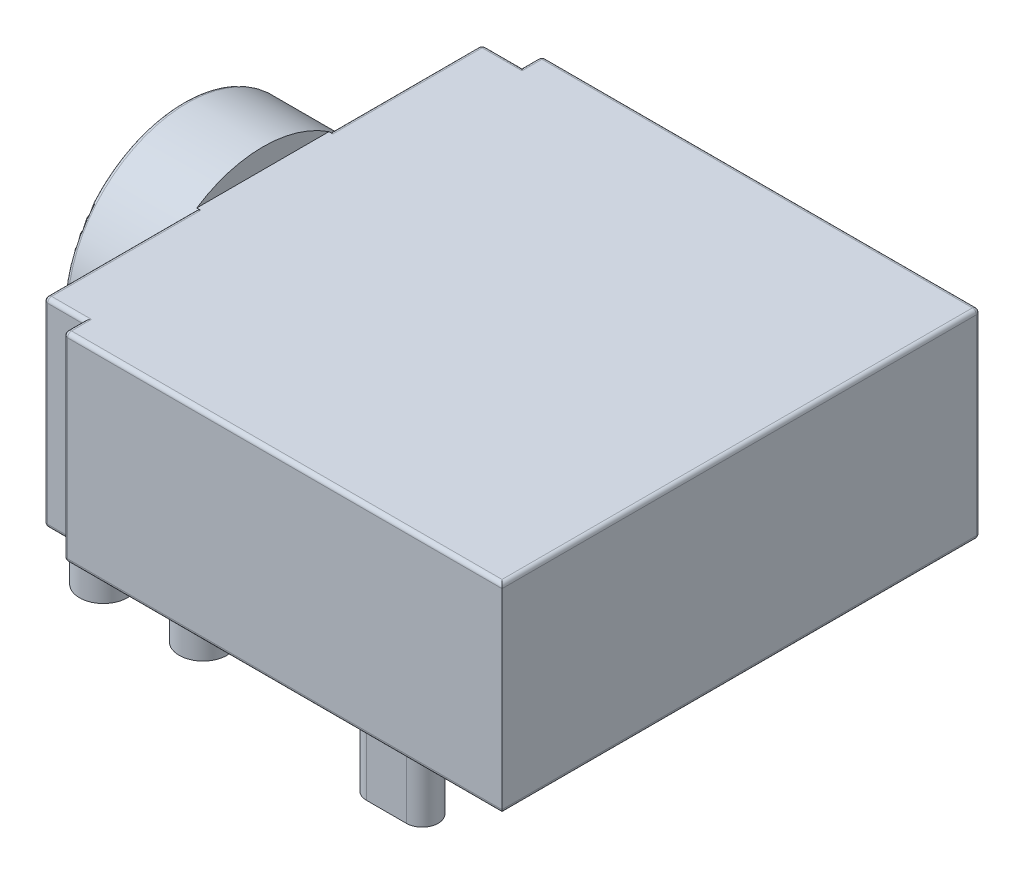
from build123d import *

# Parameters (mm, degrees)
SKETCH_1_W          = 11
SKETCH_1_H          = 12
EXTRUDE_1_DEPTH     = 5
SKETCH_2_W          = 11
SKETCH_2_H          = 5
EXTRUDE_2_DEPTH     = 1
SKETCH_3_R          = 3
EXTRUDE_3_DEPTH     = 2
SKETCH_4_R          = 1.8
CUT_EXTRUDE_1_DEPTH = 2
FILLET_1_R          = 0.1
FILLET_2_R          = 0.1
EXTRUDE_4_DEPTH     = 2
SKETCH_6_R          = 0.6
EXTRUDE_5_DEPTH     = 1


with BuildPart() as part:
    # Эскиз1 → Бобышка-Вытянуть1 (new body)
    with BuildSketch(Plane(origin=(0, 0, 0), x_dir=(1, 0, 0), z_dir=(0, 1, 0))):
        Rectangle(SKETCH_1_W, SKETCH_1_H)
    extrude(amount=EXTRUDE_1_DEPTH)

    # Эскиз2 → Бобышка-Вытянуть2 (add)
    with BuildSketch(Plane.ZY.offset(5.5)):
        with Locations((0, 2.5)):
            Rectangle(SKETCH_2_W, SKETCH_2_H)
    extrude(amount=EXTRUDE_2_DEPTH)

    # Эскиз3 → Бобышка-Вытянуть3 (add)
    with BuildSketch(Plane.ZY.offset(6.5)):
        with Locations(Location((0, 2.5, 0), (0, 0, 123.557309762))):
            Circle(SKETCH_3_R)
    extrude(amount=EXTRUDE_3_DEPTH)

    # Эскиз4 → Вырез-Вытянуть1 (cut)
    with BuildSketch(Plane.ZY.offset(8.5)):
        with Locations((0, 2.5)):
            Circle(SKETCH_4_R)
    extrude(amount=-CUT_EXTRUDE_1_DEPTH, mode=Mode.SUBTRACT)

    # Скругление1
    fillet_1_edges = [part.edges().sort_by_distance(p)[0] for p in [
        (-8.5, 0, 1.658312395),
        (-8.5, 2.5, -1.8),
    ]]
    fillet(fillet_1_edges, radius=FILLET_1_R)

    # Скругление2
    # the kernel refuses this fillet: 0.1 mm, written as the material it takes off along each edge
    with BuildSketch(Plane(origin=(-5.4, 4.9, -5.9), x_dir=(0, 0, -1), z_dir=(-1, 0, 0))) as fillet_2_piece_1_section:
        Polygon((0, 0), (FILLET_2_R * 1.02, 0), (FILLET_2_R * 1.02, -FILLET_2_R * 1.02), (0, -FILLET_2_R * 1.02), align=None)
    fillet_2_piece_1 = extrude(amount=FILLET_2_R * 1.02, mode=Mode.PRIVATE)
    fillet_2_piece_1 = fillet_2_piece_1 - Plane(origin=(-5.4, 4.9, -5.9), x_dir=(0, -0.7071067811865475, 0.7071067811865475), z_dir=(-1, 0, 0)) * Sphere(FILLET_2_R, mode=Mode.PRIVATE)
    add(fillet_2_piece_1, mode=Mode.SUBTRACT)
    with BuildSketch(Plane(origin=(-5.4, 4.9, 5.9), x_dir=(0, 0, 1), z_dir=(-1, 0, 0))) as fillet_2_piece_2_section:
        Polygon((0, 0), (FILLET_2_R * 1.02, 0), (FILLET_2_R * 1.02, FILLET_2_R * 1.02), (0, FILLET_2_R * 1.02), align=None)
    fillet_2_piece_2 = extrude(amount=FILLET_2_R * 1.02, mode=Mode.PRIVATE)
    fillet_2_piece_2 = fillet_2_piece_2 - Plane(origin=(-5.4, 4.9, 5.9), x_dir=(0, -0.7071067811865475, -0.7071067811865475), z_dir=(-1, 0, 0)) * Sphere(FILLET_2_R, mode=Mode.PRIVATE)
    add(fillet_2_piece_2, mode=Mode.SUBTRACT)
    with BuildSketch(Plane(origin=(-5.4, 0.1, 5.9), x_dir=(0, 0, 1), z_dir=(0, -1, 0))) as fillet_2_piece_3_section:
        Polygon((0, 0), (FILLET_2_R * 1.02, 0), (FILLET_2_R * 1.02, FILLET_2_R * 1.02), (0, FILLET_2_R * 1.02), align=None)
    fillet_2_piece_3 = extrude(amount=FILLET_2_R * 1.02, mode=Mode.PRIVATE)
    fillet_2_piece_3 = fillet_2_piece_3 - Plane(origin=(-5.4, 0.1, 5.9), x_dir=(0.7071067811865475, 0, -0.7071067811865477), z_dir=(0, -1, 0)) * Sphere(FILLET_2_R, mode=Mode.PRIVATE)
    add(fillet_2_piece_3, mode=Mode.SUBTRACT)
    with BuildSketch(Plane(origin=(-6.4, 0.1, 5.4), x_dir=(0, 0, 1), z_dir=(0, -1, 0))) as fillet_2_piece_4_section:
        Polygon((0, 0), (FILLET_2_R * 1.02, 0), (FILLET_2_R * 1.02, FILLET_2_R * 1.02), (0, FILLET_2_R * 1.02), align=None)
    fillet_2_piece_4 = extrude(amount=FILLET_2_R * 1.02, mode=Mode.PRIVATE)
    fillet_2_piece_4 = fillet_2_piece_4 - Plane(origin=(-6.4, 0.1, 5.4), x_dir=(0.7071067811865474, 0, -0.7071067811865477), z_dir=(0, -1, 0)) * Sphere(FILLET_2_R, mode=Mode.PRIVATE)
    add(fillet_2_piece_4, mode=Mode.SUBTRACT)
    with BuildSketch(Plane(origin=(-6.4, 4.9, 5.4), x_dir=(-1, 0, 0), z_dir=(0, 0, 1))) as fillet_2_piece_5_section:
        Polygon((0, 0), (FILLET_2_R * 1.02, 0), (FILLET_2_R * 1.02, -FILLET_2_R * 1.02), (0, -FILLET_2_R * 1.02), align=None)
    fillet_2_piece_5 = extrude(amount=FILLET_2_R * 1.02, mode=Mode.PRIVATE)
    fillet_2_piece_5 = fillet_2_piece_5 - Plane(origin=(-6.4, 4.9, 5.4), x_dir=(0.7071067811865475, -0.7071067811865475, 0), z_dir=(0, 0, 1)) * Sphere(FILLET_2_R, mode=Mode.PRIVATE)
    add(fillet_2_piece_5, mode=Mode.SUBTRACT)
    with BuildSketch(Plane(origin=(-6.4, 4.9, -5.4), x_dir=(-1, 0, 0), z_dir=(0, 0, -1))) as fillet_2_piece_6_section:
        Polygon((0, 0), (FILLET_2_R * 1.02, 0), (FILLET_2_R * 1.02, FILLET_2_R * 1.02), (0, FILLET_2_R * 1.02), align=None)
    fillet_2_piece_6 = extrude(amount=FILLET_2_R * 1.02, mode=Mode.PRIVATE)
    fillet_2_piece_6 = fillet_2_piece_6 - Plane(origin=(-6.4, 4.9, -5.4), x_dir=(0.7071067811865475, -0.7071067811865475, 0), z_dir=(0, 0, -1)) * Sphere(FILLET_2_R, mode=Mode.PRIVATE)
    add(fillet_2_piece_6, mode=Mode.SUBTRACT)
    with BuildSketch(Plane(origin=(-6.4, 0.1, -5.4), x_dir=(0, 0, -1), z_dir=(0, -1, 0))) as fillet_2_piece_7_section:
        Polygon((0, 0), (FILLET_2_R * 1.02, 0), (FILLET_2_R * 1.02, -FILLET_2_R * 1.02), (0, -FILLET_2_R * 1.02), align=None)
    fillet_2_piece_7 = extrude(amount=FILLET_2_R * 1.02, mode=Mode.PRIVATE)
    fillet_2_piece_7 = fillet_2_piece_7 - Plane(origin=(-6.4, 0.1, -5.4), x_dir=(0.7071067811865477, 0, 0.7071067811865474), z_dir=(0, -1, 0)) * Sphere(FILLET_2_R, mode=Mode.PRIVATE)
    add(fillet_2_piece_7, mode=Mode.SUBTRACT)
    with BuildSketch(Plane(origin=(5.4, 4.9, -5.9), x_dir=(1, 0, 0), z_dir=(0, 0, -1))) as fillet_2_piece_8_section:
        Polygon((0, 0), (FILLET_2_R * 1.02, 0), (FILLET_2_R * 1.02, -FILLET_2_R * 1.02), (0, -FILLET_2_R * 1.02), align=None)
    fillet_2_piece_8 = extrude(amount=FILLET_2_R * 1.02, mode=Mode.PRIVATE)
    fillet_2_piece_8 = fillet_2_piece_8 - Plane(origin=(5.4, 4.9, -5.9), x_dir=(-0.7071067811865475, -0.7071067811865475, 0), z_dir=(0, 0, -1)) * Sphere(FILLET_2_R, mode=Mode.PRIVATE)
    add(fillet_2_piece_8, mode=Mode.SUBTRACT)
    with BuildSketch(Plane(origin=(-5.4, 0.1, -5.9), x_dir=(-1, 0, 0), z_dir=(0, -1, 0))) as fillet_2_piece_9_section:
        Polygon((0, 0), (FILLET_2_R * 1.02, 0), (FILLET_2_R * 1.02, FILLET_2_R * 1.02), (0, FILLET_2_R * 1.02), align=None)
    fillet_2_piece_9 = extrude(amount=FILLET_2_R * 1.02, mode=Mode.PRIVATE)
    fillet_2_piece_9 = fillet_2_piece_9 - Plane(origin=(-5.4, 0.1, -5.9), x_dir=(0.7071067811865476, 0, 0.7071067811865475), z_dir=(0, -1, 0)) * Sphere(FILLET_2_R, mode=Mode.PRIVATE)
    add(fillet_2_piece_9, mode=Mode.SUBTRACT)
    with BuildSketch(Plane(origin=(5.4, 0.1, -5.9), x_dir=(0, 0, -1), z_dir=(0, -1, 0))) as fillet_2_piece_10_section:
        Polygon((0, 0), (FILLET_2_R * 1.02, 0), (FILLET_2_R * 1.02, FILLET_2_R * 1.02), (0, FILLET_2_R * 1.02), align=None)
    fillet_2_piece_10 = extrude(amount=FILLET_2_R * 1.02, mode=Mode.PRIVATE)
    fillet_2_piece_10 = fillet_2_piece_10 - Plane(origin=(5.4, 0.1, -5.9), x_dir=(-0.7071067811865475, 0, 0.7071067811865477), z_dir=(0, -1, 0)) * Sphere(FILLET_2_R, mode=Mode.PRIVATE)
    add(fillet_2_piece_10, mode=Mode.SUBTRACT)
    with BuildSketch(Plane(origin=(-5.5, 5, -5.5), x_dir=(1, 0, 0), z_dir=(0, 0, -1)), Plane(origin=(-5.5, 5, 5.9), x_dir=(1, 0, 0), z_dir=(0, 0, -1))) as fillet_2_piece_11:
        with BuildLine():
            CenterArc((FILLET_2_R, FILLET_2_R), FILLET_2_R, 180, 90)
            Line((0, FILLET_2_R), (-FILLET_2_R * 0.02, FILLET_2_R))
            Line((-FILLET_2_R * 0.02, FILLET_2_R), (-FILLET_2_R * 0.02, -FILLET_2_R * 0.02))
            Line((-FILLET_2_R * 0.02, -FILLET_2_R * 0.02), (FILLET_2_R, -FILLET_2_R * 0.02))
            Line((FILLET_2_R, -FILLET_2_R * 0.02), (FILLET_2_R, 0))
        make_face()
    extrude(amount=0.4, mode=Mode.SUBTRACT)
    with BuildSketch(Plane(origin=(5.5, 5, 6), x_dir=(0, 0, -1), z_dir=(-1, 0, 0))) as fillet_2_piece_12:
        with BuildLine():
            CenterArc((FILLET_2_R, FILLET_2_R), FILLET_2_R, 180, 90)
            Line((0, FILLET_2_R), (-FILLET_2_R * 0.02, FILLET_2_R))
            Line((-FILLET_2_R * 0.02, FILLET_2_R), (-FILLET_2_R * 0.02, -FILLET_2_R * 0.02))
            Line((-FILLET_2_R * 0.02, -FILLET_2_R * 0.02), (FILLET_2_R, -FILLET_2_R * 0.02))
            Line((FILLET_2_R, -FILLET_2_R * 0.02), (FILLET_2_R, 0))
        make_face()
    extrude(amount=10.9, mode=Mode.SUBTRACT)
    with BuildSketch(Plane(origin=(-5.5, 0, 5.9), x_dir=(1, 0, 0), z_dir=(0, 0, -1)), Plane(origin=(-5.5, 0, -5.5), x_dir=(1, 0, 0), z_dir=(0, 0, -1))) as fillet_2_piece_13:
        with BuildLine():
            CenterArc((FILLET_2_R, -FILLET_2_R), FILLET_2_R, 90, 90)
            Line((0, -FILLET_2_R), (-FILLET_2_R * 0.02, -FILLET_2_R))
            Line((-FILLET_2_R * 0.02, -FILLET_2_R), (-FILLET_2_R * 0.02, FILLET_2_R * 0.02))
            Line((-FILLET_2_R * 0.02, FILLET_2_R * 0.02), (FILLET_2_R, FILLET_2_R * 0.02))
            Line((FILLET_2_R, FILLET_2_R * 0.02), (FILLET_2_R, 0))
        make_face()
    extrude(amount=0.4, mode=Mode.SUBTRACT)
    with BuildSketch(Plane(origin=(-5.5, 0, 5.5), x_dir=(0, 0, -1), z_dir=(-1, 0, 0)), Plane(origin=(-5.5, 5, -5.5), x_dir=(0, 0, 1), z_dir=(-1, 0, 0))) as fillet_2_piece_14:
        with BuildLine():
            CenterArc((FILLET_2_R, -FILLET_2_R), FILLET_2_R, 90, 90)
            Line((0, -FILLET_2_R), (-FILLET_2_R * 0.02, -FILLET_2_R))
            Line((-FILLET_2_R * 0.02, -FILLET_2_R), (-FILLET_2_R * 0.02, FILLET_2_R * 0.02))
            Line((-FILLET_2_R * 0.02, FILLET_2_R * 0.02), (FILLET_2_R, FILLET_2_R * 0.02))
            Line((FILLET_2_R, FILLET_2_R * 0.02), (FILLET_2_R, 0))
        make_face()
    extrude(amount=0.9, mode=Mode.SUBTRACT)
    with BuildSketch(Plane(origin=(-5.5, 5, 5.5), x_dir=(0, 0, -1), z_dir=(-1, 0, 0)), Plane(origin=(-5.5, 0, -5.5), x_dir=(0, 0, 1), z_dir=(-1, 0, 0))) as fillet_2_piece_15:
        with BuildLine():
            CenterArc((FILLET_2_R, FILLET_2_R), FILLET_2_R, 180, 90)
            Line((0, FILLET_2_R), (-FILLET_2_R * 0.02, FILLET_2_R))
            Line((-FILLET_2_R * 0.02, FILLET_2_R), (-FILLET_2_R * 0.02, -FILLET_2_R * 0.02))
            Line((-FILLET_2_R * 0.02, -FILLET_2_R * 0.02), (FILLET_2_R, -FILLET_2_R * 0.02))
            Line((FILLET_2_R, -FILLET_2_R * 0.02), (FILLET_2_R, 0))
        make_face()
    extrude(amount=0.9, mode=Mode.SUBTRACT)
    with BuildSketch(Plane(origin=(-6.5, 4.9, 5.5), x_dir=(0, 0, -1), z_dir=(0, -1, 0)), Plane(origin=(-6.5, 0.1, -5.5), x_dir=(0, 0, 1), z_dir=(0, 1, 0)), Plane(origin=(-5.5, 0.1, 6), x_dir=(1, 0, 0), z_dir=(0, 1, 0)), Plane(origin=(5.5, 0.1, -6), x_dir=(-1, 0, 0), z_dir=(0, 1, 0))) as fillet_2_piece_16:
        with BuildLine():
            CenterArc((FILLET_2_R, FILLET_2_R), FILLET_2_R, 180, 90)
            Line((0, FILLET_2_R), (-FILLET_2_R * 0.02, FILLET_2_R))
            Line((-FILLET_2_R * 0.02, FILLET_2_R), (-FILLET_2_R * 0.02, -FILLET_2_R * 0.02))
            Line((-FILLET_2_R * 0.02, -FILLET_2_R * 0.02), (FILLET_2_R, -FILLET_2_R * 0.02))
            Line((FILLET_2_R, -FILLET_2_R * 0.02), (FILLET_2_R, 0))
        make_face()
    extrude(amount=4.8, mode=Mode.SUBTRACT)
    with BuildSketch(Plane(origin=(-6.5, 5, 1.408312395), x_dir=(0, -1, 0), z_dir=(0, 0, 1))) as fillet_2_piece_17_section:
        with BuildLine():
            CenterArc((FILLET_2_R, FILLET_2_R), FILLET_2_R, 180, 90)
            Line((0, FILLET_2_R), (-FILLET_2_R * 0.02, FILLET_2_R))
            Line((-FILLET_2_R * 0.02, FILLET_2_R), (-FILLET_2_R * 0.02, -FILLET_2_R * 0.02))
            Line((-FILLET_2_R * 0.02, -FILLET_2_R * 0.02), (FILLET_2_R, -FILLET_2_R * 0.02))
            Line((FILLET_2_R, -FILLET_2_R * 0.02), (FILLET_2_R, 0))
        make_face()
    fillet_2_piece_17 = extrude(amount=3.991687605, mode=Mode.PRIVATE)
    fillet_2_piece_17 = fillet_2_piece_17 - Plane(origin=(-6.475210822, 2.5, 0), x_dir=(0, 0.8333333333325684, -0.5527707983937198), z_dir=(1, 0, 0)) * Cylinder(3, 9, mode=Mode.PRIVATE)
    fillet_2_piece_17 = split(fillet_2_piece_17, bisect_by=Plane(origin=(-6.5, 4.979795043, 3.544023881), z_dir=(1, 0, 0)), keep=Keep.TOP, mode=Mode.PRIVATE)
    add(fillet_2_piece_17, mode=Mode.SUBTRACT)
    with BuildSketch(Plane(origin=(-6.5, 0, -1.408312395), x_dir=(0, 1, 0), z_dir=(0, 0, -1))) as fillet_2_piece_18_section:
        with BuildLine():
            CenterArc((FILLET_2_R, FILLET_2_R), FILLET_2_R, 180, 90)
            Line((0, FILLET_2_R), (-FILLET_2_R * 0.02, FILLET_2_R))
            Line((-FILLET_2_R * 0.02, FILLET_2_R), (-FILLET_2_R * 0.02, -FILLET_2_R * 0.02))
            Line((-FILLET_2_R * 0.02, -FILLET_2_R * 0.02), (FILLET_2_R, -FILLET_2_R * 0.02))
            Line((FILLET_2_R, -FILLET_2_R * 0.02), (FILLET_2_R, 0))
        make_face()
    fillet_2_piece_18 = extrude(amount=3.991687605, mode=Mode.PRIVATE)
    fillet_2_piece_18 = fillet_2_piece_18 - Plane(origin=(-6.475210754, 2.5, 0), x_dir=(0, 0.8333333333325684, -0.5527707983937198), z_dir=(1, 0, 0)) * Cylinder(3, 9, mode=Mode.PRIVATE)
    fillet_2_piece_18 = split(fillet_2_piece_18, bisect_by=Plane(origin=(-6.5, 0.02020498, -3.544022332), z_dir=(1, 0, 0)), keep=Keep.TOP, mode=Mode.PRIVATE)
    add(fillet_2_piece_18, mode=Mode.SUBTRACT)
    with BuildSketch(Plane(origin=(-6.5, 5, -5.4), x_dir=(0, -1, 0), z_dir=(0, 0, 1))) as fillet_2_piece_19_section:
        with BuildLine():
            CenterArc((FILLET_2_R, FILLET_2_R), FILLET_2_R, 180, 90)
            Line((0, FILLET_2_R), (-FILLET_2_R * 0.02, FILLET_2_R))
            Line((-FILLET_2_R * 0.02, FILLET_2_R), (-FILLET_2_R * 0.02, -FILLET_2_R * 0.02))
            Line((-FILLET_2_R * 0.02, -FILLET_2_R * 0.02), (FILLET_2_R, -FILLET_2_R * 0.02))
            Line((FILLET_2_R, -FILLET_2_R * 0.02), (FILLET_2_R, 0))
        make_face()
    fillet_2_piece_19 = extrude(amount=3.991687605, mode=Mode.PRIVATE)
    fillet_2_piece_19 = fillet_2_piece_19 - Plane(origin=(-6.475210759, 2.5, 0), x_dir=(0, 0.8333333333325684, -0.5527707983937198), z_dir=(1, 0, 0)) * Cylinder(3, 9, mode=Mode.PRIVATE)
    fillet_2_piece_19 = split(fillet_2_piece_19, bisect_by=Plane(origin=(-6.5, 4.97979501, -3.544021724), z_dir=(1, 0, 0)), keep=Keep.TOP, mode=Mode.PRIVATE)
    add(fillet_2_piece_19, mode=Mode.SUBTRACT)
    with BuildSketch(Plane(origin=(-6.5, 0, 5.4), x_dir=(0, 1, 0), z_dir=(0, 0, -1))) as fillet_2_piece_20_section:
        with BuildLine():
            CenterArc((FILLET_2_R, FILLET_2_R), FILLET_2_R, 180, 90)
            Line((0, FILLET_2_R), (-FILLET_2_R * 0.02, FILLET_2_R))
            Line((-FILLET_2_R * 0.02, FILLET_2_R), (-FILLET_2_R * 0.02, -FILLET_2_R * 0.02))
            Line((-FILLET_2_R * 0.02, -FILLET_2_R * 0.02), (FILLET_2_R, -FILLET_2_R * 0.02))
            Line((FILLET_2_R, -FILLET_2_R * 0.02), (FILLET_2_R, 0))
        make_face()
    fillet_2_piece_20 = extrude(amount=3.991687605, mode=Mode.PRIVATE)
    fillet_2_piece_20 = fillet_2_piece_20 - Plane(origin=(-6.47521076, 2.5, 0), x_dir=(0, 0.8333333333325684, -0.5527707983937198), z_dir=(1, 0, 0)) * Cylinder(3, 9, mode=Mode.PRIVATE)
    fillet_2_piece_20 = split(fillet_2_piece_20, bisect_by=Plane(origin=(-6.5, 0.020204991, 3.54402165), z_dir=(1, 0, 0)), keep=Keep.TOP, mode=Mode.PRIVATE)
    add(fillet_2_piece_20, mode=Mode.SUBTRACT)
    with BuildSketch(Plane(origin=(5.5, 5, -5.9), x_dir=(-1, 0, 0), z_dir=(0, 0, 1))) as fillet_2_piece_21:
        with BuildLine():
            CenterArc((FILLET_2_R, FILLET_2_R), FILLET_2_R, 180, 90)
            Line((0, FILLET_2_R), (-FILLET_2_R * 0.02, FILLET_2_R))
            Line((-FILLET_2_R * 0.02, FILLET_2_R), (-FILLET_2_R * 0.02, -FILLET_2_R * 0.02))
            Line((-FILLET_2_R * 0.02, -FILLET_2_R * 0.02), (FILLET_2_R, -FILLET_2_R * 0.02))
            Line((FILLET_2_R, -FILLET_2_R * 0.02), (FILLET_2_R, 0))
        make_face()
    extrude(amount=11.9, mode=Mode.SUBTRACT)
    with BuildSketch(Plane(origin=(5.5, 0, 6), x_dir=(0, 0, -1), z_dir=(-1, 0, 0))) as fillet_2_piece_22:
        with BuildLine():
            CenterArc((FILLET_2_R, -FILLET_2_R), FILLET_2_R, 90, 90)
            Line((0, -FILLET_2_R), (-FILLET_2_R * 0.02, -FILLET_2_R))
            Line((-FILLET_2_R * 0.02, -FILLET_2_R), (-FILLET_2_R * 0.02, FILLET_2_R * 0.02))
            Line((-FILLET_2_R * 0.02, FILLET_2_R * 0.02), (FILLET_2_R, FILLET_2_R * 0.02))
            Line((FILLET_2_R, FILLET_2_R * 0.02), (FILLET_2_R, 0))
        make_face()
    extrude(amount=10.9, mode=Mode.SUBTRACT)
    with BuildSketch(Plane(origin=(-5.4, 0, -6), x_dir=(0, 0, 1), z_dir=(1, 0, 0))) as fillet_2_piece_23:
        with BuildLine():
            CenterArc((FILLET_2_R, -FILLET_2_R), FILLET_2_R, 90, 90)
            Line((0, -FILLET_2_R), (-FILLET_2_R * 0.02, -FILLET_2_R))
            Line((-FILLET_2_R * 0.02, -FILLET_2_R), (-FILLET_2_R * 0.02, FILLET_2_R * 0.02))
            Line((-FILLET_2_R * 0.02, FILLET_2_R * 0.02), (FILLET_2_R, FILLET_2_R * 0.02))
            Line((FILLET_2_R, FILLET_2_R * 0.02), (FILLET_2_R, 0))
        make_face()
    extrude(amount=10.8, mode=Mode.SUBTRACT)
    with BuildSketch(Plane(origin=(5.5, 0, -5.9), x_dir=(-1, 0, 0), z_dir=(0, 0, 1))) as fillet_2_piece_24:
        with BuildLine():
            CenterArc((FILLET_2_R, -FILLET_2_R), FILLET_2_R, 90, 90)
            Line((0, -FILLET_2_R), (-FILLET_2_R * 0.02, -FILLET_2_R))
            Line((-FILLET_2_R * 0.02, -FILLET_2_R), (-FILLET_2_R * 0.02, FILLET_2_R * 0.02))
            Line((-FILLET_2_R * 0.02, FILLET_2_R * 0.02), (FILLET_2_R, FILLET_2_R * 0.02))
            Line((FILLET_2_R, FILLET_2_R * 0.02), (FILLET_2_R, 0))
        make_face()
    extrude(amount=11.9, mode=Mode.SUBTRACT)
    with BuildSketch(Plane(origin=(-5.4, 5, -6), x_dir=(0, 0, 1), z_dir=(1, 0, 0))) as fillet_2_piece_25:
        with BuildLine():
            CenterArc((FILLET_2_R, FILLET_2_R), FILLET_2_R, 180, 90)
            Line((0, FILLET_2_R), (-FILLET_2_R * 0.02, FILLET_2_R))
            Line((-FILLET_2_R * 0.02, FILLET_2_R), (-FILLET_2_R * 0.02, -FILLET_2_R * 0.02))
            Line((-FILLET_2_R * 0.02, -FILLET_2_R * 0.02), (FILLET_2_R, -FILLET_2_R * 0.02))
            Line((FILLET_2_R, -FILLET_2_R * 0.02), (FILLET_2_R, 0))
        make_face()
    extrude(amount=10.8, mode=Mode.SUBTRACT)
    with BuildSketch(Plane(origin=(-5.5, 0.1, -6), x_dir=(1, 0, 0), z_dir=(0, 1, 0))) as fillet_2_piece_26:
        with BuildLine():
            CenterArc((FILLET_2_R, -FILLET_2_R), FILLET_2_R, 90, 90)
            Line((0, -FILLET_2_R), (-FILLET_2_R * 0.02, -FILLET_2_R))
            Line((-FILLET_2_R * 0.02, -FILLET_2_R), (-FILLET_2_R * 0.02, FILLET_2_R * 0.02))
            Line((-FILLET_2_R * 0.02, FILLET_2_R * 0.02), (FILLET_2_R, FILLET_2_R * 0.02))
            Line((FILLET_2_R, FILLET_2_R * 0.02), (FILLET_2_R, 0))
        make_face()
    extrude(amount=4.8, mode=Mode.SUBTRACT)
    with BuildSketch(Plane(origin=(-5.25, 5, -5.5), x_dir=(0, 0, 1), z_dir=(-1, 0, 0))) as fillet_2_piece_27a_section:
        with BuildLine():
            CenterArc((FILLET_2_R, -FILLET_2_R), FILLET_2_R, 90, 90)
            Line((0, -FILLET_2_R), (-FILLET_2_R * 0.02, -FILLET_2_R))
            Line((-FILLET_2_R * 0.02, -FILLET_2_R), (-FILLET_2_R * 0.02, FILLET_2_R * 0.02))
            Line((-FILLET_2_R * 0.02, FILLET_2_R * 0.02), (FILLET_2_R, FILLET_2_R * 0.02))
            Line((FILLET_2_R, FILLET_2_R * 0.02), (FILLET_2_R, 0))
        make_face()
    fillet_2_piece_27a = extrude(amount=1.15, mode=Mode.PRIVATE)
    fillet_2_piece_27a = split(fillet_2_piece_27a, bisect_by=Plane(origin=(-5.5, 4.977360489, -5.477360489), z_dir=(1, 0, 0)), keep=Keep.TOP, mode=Mode.PRIVATE)
    with BuildSketch(Plane(origin=(-5.5, 5, -5.25), x_dir=(1, 0, 0), z_dir=(0, 0, -1))) as fillet_2_piece_27b_section:
        with BuildLine():
            CenterArc((FILLET_2_R, FILLET_2_R), FILLET_2_R, 180, 90)
            Line((0, FILLET_2_R), (-FILLET_2_R * 0.02, FILLET_2_R))
            Line((-FILLET_2_R * 0.02, FILLET_2_R), (-FILLET_2_R * 0.02, -FILLET_2_R * 0.02))
            Line((-FILLET_2_R * 0.02, -FILLET_2_R * 0.02), (FILLET_2_R, -FILLET_2_R * 0.02))
            Line((FILLET_2_R, -FILLET_2_R * 0.02), (FILLET_2_R, 0))
        make_face()
    fillet_2_piece_27b = extrude(amount=0.65, mode=Mode.PRIVATE)
    fillet_2_piece_27b = split(fillet_2_piece_27b, bisect_by=Plane(origin=(-5.477360489, 4.977360489, -5.5), z_dir=(0, 0, 1)), keep=Keep.TOP, mode=Mode.PRIVATE)
    fillet_2_piece_27 = fillet_2_piece_27a & fillet_2_piece_27b
    add(fillet_2_piece_27, mode=Mode.SUBTRACT)
    with BuildSketch(Plane(origin=(5.5, 5, -5.9), x_dir=(-1, 0, 0), z_dir=(0, 0, 1))) as fillet_2_piece_28a_section:
        with BuildLine():
            CenterArc((FILLET_2_R, FILLET_2_R), FILLET_2_R, 180, 90)
            Line((0, FILLET_2_R), (-FILLET_2_R * 0.02, FILLET_2_R))
            Line((-FILLET_2_R * 0.02, FILLET_2_R), (-FILLET_2_R * 0.02, -FILLET_2_R * 0.02))
            Line((-FILLET_2_R * 0.02, -FILLET_2_R * 0.02), (FILLET_2_R, -FILLET_2_R * 0.02))
            Line((FILLET_2_R, -FILLET_2_R * 0.02), (FILLET_2_R, 0))
        make_face()
    fillet_2_piece_28a = extrude(amount=12.15, mode=Mode.PRIVATE)
    fillet_2_piece_28a = split(fillet_2_piece_28a, bisect_by=Plane(origin=(5.477360489, 4.977360489, 6), z_dir=(0, 0, 1)), keep=Keep.TOP, mode=Mode.PRIVATE)
    with BuildSketch(Plane(origin=(5.75, 5, 6), x_dir=(0, 0, -1), z_dir=(-1, 0, 0))) as fillet_2_piece_28b_section:
        with BuildLine():
            CenterArc((FILLET_2_R, FILLET_2_R), FILLET_2_R, 180, 90)
            Line((0, FILLET_2_R), (-FILLET_2_R * 0.02, FILLET_2_R))
            Line((-FILLET_2_R * 0.02, FILLET_2_R), (-FILLET_2_R * 0.02, -FILLET_2_R * 0.02))
            Line((-FILLET_2_R * 0.02, -FILLET_2_R * 0.02), (FILLET_2_R, -FILLET_2_R * 0.02))
            Line((FILLET_2_R, -FILLET_2_R * 0.02), (FILLET_2_R, 0))
        make_face()
    fillet_2_piece_28b = extrude(amount=11.15, mode=Mode.PRIVATE)
    fillet_2_piece_28b = split(fillet_2_piece_28b, bisect_by=Plane(origin=(5.5, 4.977360489, 5.977360489), z_dir=(1, 0, 0)), keep=Keep.TOP, mode=Mode.PRIVATE)
    fillet_2_piece_28 = fillet_2_piece_28a & fillet_2_piece_28b
    add(fillet_2_piece_28, mode=Mode.SUBTRACT)
    with BuildSketch(Plane(origin=(-5.5, 0, 5.9), x_dir=(1, 0, 0), z_dir=(0, 0, -1))) as fillet_2_piece_29a_section:
        with BuildLine():
            CenterArc((FILLET_2_R, -FILLET_2_R), FILLET_2_R, 90, 90)
            Line((0, -FILLET_2_R), (-FILLET_2_R * 0.02, -FILLET_2_R))
            Line((-FILLET_2_R * 0.02, -FILLET_2_R), (-FILLET_2_R * 0.02, FILLET_2_R * 0.02))
            Line((-FILLET_2_R * 0.02, FILLET_2_R * 0.02), (FILLET_2_R, FILLET_2_R * 0.02))
            Line((FILLET_2_R, FILLET_2_R * 0.02), (FILLET_2_R, 0))
        make_face()
    fillet_2_piece_29a = extrude(amount=0.65, mode=Mode.PRIVATE)
    fillet_2_piece_29a = split(fillet_2_piece_29a, bisect_by=Plane(origin=(-5.477360489, 0.022639511, 5.5), z_dir=(0, 0, -1)), keep=Keep.TOP, mode=Mode.PRIVATE)
    with BuildSketch(Plane(origin=(-5.25, 0, 5.5), x_dir=(0, 0, -1), z_dir=(-1, 0, 0))) as fillet_2_piece_29b_section:
        with BuildLine():
            CenterArc((FILLET_2_R, -FILLET_2_R), FILLET_2_R, 90, 90)
            Line((0, -FILLET_2_R), (-FILLET_2_R * 0.02, -FILLET_2_R))
            Line((-FILLET_2_R * 0.02, -FILLET_2_R), (-FILLET_2_R * 0.02, FILLET_2_R * 0.02))
            Line((-FILLET_2_R * 0.02, FILLET_2_R * 0.02), (FILLET_2_R, FILLET_2_R * 0.02))
            Line((FILLET_2_R, FILLET_2_R * 0.02), (FILLET_2_R, 0))
        make_face()
    fillet_2_piece_29b = extrude(amount=1.15, mode=Mode.PRIVATE)
    fillet_2_piece_29b = split(fillet_2_piece_29b, bisect_by=Plane(origin=(-5.5, 0.022639511, 5.477360489), z_dir=(1, 0, 0)), keep=Keep.TOP, mode=Mode.PRIVATE)
    fillet_2_piece_29 = fillet_2_piece_29a & fillet_2_piece_29b
    add(fillet_2_piece_29, mode=Mode.SUBTRACT)
    with BuildSketch(Plane(origin=(-5.5, 5, 5.9), x_dir=(1, 0, 0), z_dir=(0, 0, -1))) as fillet_2_piece_30a_section:
        with BuildLine():
            CenterArc((FILLET_2_R, FILLET_2_R), FILLET_2_R, 180, 90)
            Line((0, FILLET_2_R), (-FILLET_2_R * 0.02, FILLET_2_R))
            Line((-FILLET_2_R * 0.02, FILLET_2_R), (-FILLET_2_R * 0.02, -FILLET_2_R * 0.02))
            Line((-FILLET_2_R * 0.02, -FILLET_2_R * 0.02), (FILLET_2_R, -FILLET_2_R * 0.02))
            Line((FILLET_2_R, -FILLET_2_R * 0.02), (FILLET_2_R, 0))
        make_face()
    fillet_2_piece_30a = extrude(amount=0.65, mode=Mode.PRIVATE)
    fillet_2_piece_30a = split(fillet_2_piece_30a, bisect_by=Plane(origin=(-5.477360489, 4.977360489, 5.5), z_dir=(0, 0, -1)), keep=Keep.TOP, mode=Mode.PRIVATE)
    with BuildSketch(Plane(origin=(-5.25, 5, 5.5), x_dir=(0, 0, -1), z_dir=(-1, 0, 0))) as fillet_2_piece_30b_section:
        with BuildLine():
            CenterArc((FILLET_2_R, FILLET_2_R), FILLET_2_R, 180, 90)
            Line((0, FILLET_2_R), (-FILLET_2_R * 0.02, FILLET_2_R))
            Line((-FILLET_2_R * 0.02, FILLET_2_R), (-FILLET_2_R * 0.02, -FILLET_2_R * 0.02))
            Line((-FILLET_2_R * 0.02, -FILLET_2_R * 0.02), (FILLET_2_R, -FILLET_2_R * 0.02))
            Line((FILLET_2_R, -FILLET_2_R * 0.02), (FILLET_2_R, 0))
        make_face()
    fillet_2_piece_30b = extrude(amount=1.15, mode=Mode.PRIVATE)
    fillet_2_piece_30b = split(fillet_2_piece_30b, bisect_by=Plane(origin=(-5.5, 4.977360489, 5.477360489), z_dir=(1, 0, 0)), keep=Keep.TOP, mode=Mode.PRIVATE)
    fillet_2_piece_30 = fillet_2_piece_30a & fillet_2_piece_30b
    add(fillet_2_piece_30, mode=Mode.SUBTRACT)
    with BuildSketch(Plane(origin=(-5.25, 0, -5.5), x_dir=(0, 0, 1), z_dir=(-1, 0, 0))) as fillet_2_piece_31a_section:
        with BuildLine():
            CenterArc((FILLET_2_R, FILLET_2_R), FILLET_2_R, 180, 90)
            Line((0, FILLET_2_R), (-FILLET_2_R * 0.02, FILLET_2_R))
            Line((-FILLET_2_R * 0.02, FILLET_2_R), (-FILLET_2_R * 0.02, -FILLET_2_R * 0.02))
            Line((-FILLET_2_R * 0.02, -FILLET_2_R * 0.02), (FILLET_2_R, -FILLET_2_R * 0.02))
            Line((FILLET_2_R, -FILLET_2_R * 0.02), (FILLET_2_R, 0))
        make_face()
    fillet_2_piece_31a = extrude(amount=1.15, mode=Mode.PRIVATE)
    fillet_2_piece_31a = split(fillet_2_piece_31a, bisect_by=Plane(origin=(-5.5, 0.022639511, -5.477360489), z_dir=(1, 0, 0)), keep=Keep.TOP, mode=Mode.PRIVATE)
    with BuildSketch(Plane(origin=(-5.5, 0, -5.25), x_dir=(1, 0, 0), z_dir=(0, 0, -1))) as fillet_2_piece_31b_section:
        with BuildLine():
            CenterArc((FILLET_2_R, -FILLET_2_R), FILLET_2_R, 90, 90)
            Line((0, -FILLET_2_R), (-FILLET_2_R * 0.02, -FILLET_2_R))
            Line((-FILLET_2_R * 0.02, -FILLET_2_R), (-FILLET_2_R * 0.02, FILLET_2_R * 0.02))
            Line((-FILLET_2_R * 0.02, FILLET_2_R * 0.02), (FILLET_2_R, FILLET_2_R * 0.02))
            Line((FILLET_2_R, FILLET_2_R * 0.02), (FILLET_2_R, 0))
        make_face()
    fillet_2_piece_31b = extrude(amount=0.65, mode=Mode.PRIVATE)
    fillet_2_piece_31b = split(fillet_2_piece_31b, bisect_by=Plane(origin=(-5.477360489, 0.022639511, -5.5), z_dir=(0, 0, 1)), keep=Keep.TOP, mode=Mode.PRIVATE)
    fillet_2_piece_31 = fillet_2_piece_31a & fillet_2_piece_31b
    add(fillet_2_piece_31, mode=Mode.SUBTRACT)
    with BuildSketch(Plane(origin=(5.5, 0, -5.9), x_dir=(-1, 0, 0), z_dir=(0, 0, 1))) as fillet_2_piece_32a_section:
        with BuildLine():
            CenterArc((FILLET_2_R, -FILLET_2_R), FILLET_2_R, 90, 90)
            Line((0, -FILLET_2_R), (-FILLET_2_R * 0.02, -FILLET_2_R))
            Line((-FILLET_2_R * 0.02, -FILLET_2_R), (-FILLET_2_R * 0.02, FILLET_2_R * 0.02))
            Line((-FILLET_2_R * 0.02, FILLET_2_R * 0.02), (FILLET_2_R, FILLET_2_R * 0.02))
            Line((FILLET_2_R, FILLET_2_R * 0.02), (FILLET_2_R, 0))
        make_face()
    fillet_2_piece_32a = extrude(amount=12.15, mode=Mode.PRIVATE)
    fillet_2_piece_32a = split(fillet_2_piece_32a, bisect_by=Plane(origin=(5.477360489, 0.022639511, 6), z_dir=(0, 0, 1)), keep=Keep.TOP, mode=Mode.PRIVATE)
    with BuildSketch(Plane(origin=(5.75, 0, 6), x_dir=(0, 0, -1), z_dir=(-1, 0, 0))) as fillet_2_piece_32b_section:
        with BuildLine():
            CenterArc((FILLET_2_R, -FILLET_2_R), FILLET_2_R, 90, 90)
            Line((0, -FILLET_2_R), (-FILLET_2_R * 0.02, -FILLET_2_R))
            Line((-FILLET_2_R * 0.02, -FILLET_2_R), (-FILLET_2_R * 0.02, FILLET_2_R * 0.02))
            Line((-FILLET_2_R * 0.02, FILLET_2_R * 0.02), (FILLET_2_R, FILLET_2_R * 0.02))
            Line((FILLET_2_R, FILLET_2_R * 0.02), (FILLET_2_R, 0))
        make_face()
    fillet_2_piece_32b = extrude(amount=11.15, mode=Mode.PRIVATE)
    fillet_2_piece_32b = split(fillet_2_piece_32b, bisect_by=Plane(origin=(5.5, 0.022639511, 5.977360489), z_dir=(1, 0, 0)), keep=Keep.TOP, mode=Mode.PRIVATE)
    fillet_2_piece_32 = fillet_2_piece_32a & fillet_2_piece_32b
    add(fillet_2_piece_32, mode=Mode.SUBTRACT)

    # Эскиз5 → Бобышка-Вытянуть4 (add)
    with BuildSketch(Plane.XZ):
        with BuildLine():
            Line((1.5, 5.4), (2.5, 5.4))
            ThreePointArc((2.5, 5.4), (2.9, 5), (2.5, 4.6))
            Line((2.5, 4.6), (1.5, 4.6))
            ThreePointArc((1.5, 4.6), (1.1, 5), (1.5, 5.4))
        make_face()
        with BuildLine():
            Line((1.5, -4.6), (2.5, -4.6))
            ThreePointArc((2.5, -4.6), (2.9, -5), (2.5, -5.4))
            Line((2.5, -5.4), (1.5, -5.4))
            ThreePointArc((1.5, -5.4), (1.1, -5), (1.5, -4.6))
        make_face()
        with BuildLine():
            Line((1.5, 2.9), (2.5, 2.9))
            ThreePointArc((2.5, 2.9), (2.9, 2.5), (2.5, 2.1))
            Line((2.5, 2.1), (1.5, 2.1))
            ThreePointArc((1.5, 2.1), (1.1, 2.5), (1.5, 2.9))
        make_face()
        with BuildLine():
            Line((1.5, -2.1), (2.5, -2.1))
            ThreePointArc((2.5, -2.1), (2.9, -2.5), (2.5, -2.9))
            Line((2.5, -2.9), (1.5, -2.9))
            ThreePointArc((1.5, -2.9), (1.1, -2.5), (1.5, -2.1))
        make_face()
        with BuildLine():
            Line((-3.4, -0.5), (-3.4, 0.5))
            ThreePointArc((-3.4, 0.5), (-3, 0.9), (-2.6, 0.5))
            Line((-2.6, 0.5), (-2.6, -0.5))
            ThreePointArc((-2.6, -0.5), (-3, -0.9), (-3.4, -0.5))
        make_face()
    extrude(amount=EXTRUDE_4_DEPTH)

    # Эскиз6 → Бобышка-Вытянуть5 (add)
    with BuildSketch(Plane.XZ):
        with Locations(Location((-3, 5, 0), (0, 0, 90))):
            Circle(SKETCH_6_R)
        with Locations(Location((-3, -5, 0), (0, 0, 90))):
            Circle(SKETCH_6_R)
        with Locations(Location((2.023541458, 0, 0), (0, 0, 90))):
            Circle(SKETCH_6_R)
        with Locations(Location((-5.5, 5, 0), (0, 0, 80.405931773))):
            Circle(SKETCH_6_R)
        with Locations(Location((-5.5, -5, 0), (0, 0, 221.810314896))):
            Circle(SKETCH_6_R)
    extrude(amount=EXTRUDE_5_DEPTH)


solid = part.part
